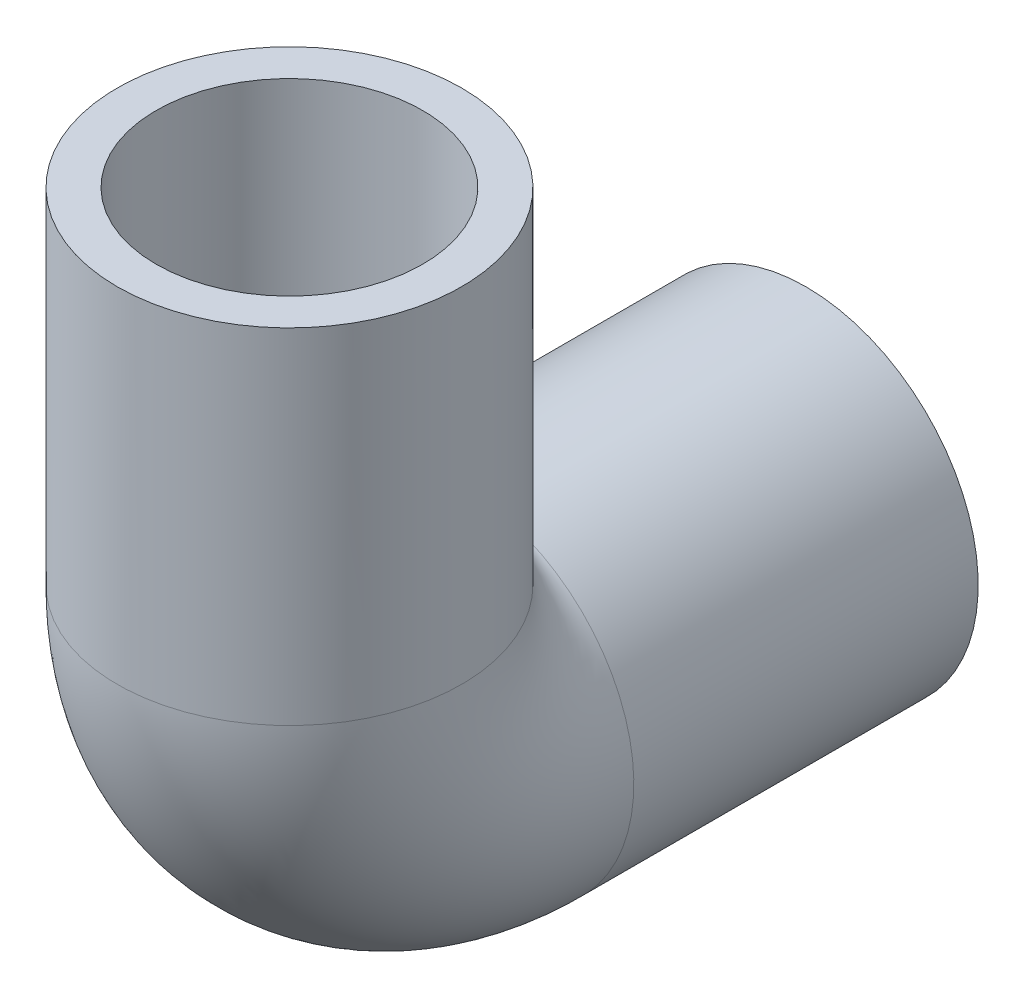
from build123d import *

# Parameters (mm, degrees)
SKETCH2_R   = 12.7
SKETCH2_R_2 = 9.8298


with BuildPart() as part:
    # Sweep1: sweep along a path in Sketch3
    with BuildLine(Plane(origin=(0, 0, 0), x_dir=(0, 0, -1), z_dir=(1, 0, 0))) as sweep1_path:
        Line((0, 0), (0, -25.4))
        ThreePointArc((0, -25.4), (3.719743879, -34.380256121), (12.7, -38.1))
        Line((12.7, -38.1), (38.1, -38.1))
    # Sketch2 → Sweep1 (sweep)
    with BuildSketch(Plane(origin=(0, 0, 0), x_dir=(1, 0, 0), z_dir=(0, 1, 0))):
        Circle(SKETCH2_R)
        Circle(SKETCH2_R_2, mode=Mode.SUBTRACT)
    sweep(path=sweep1_path.line)


solid = part.part
